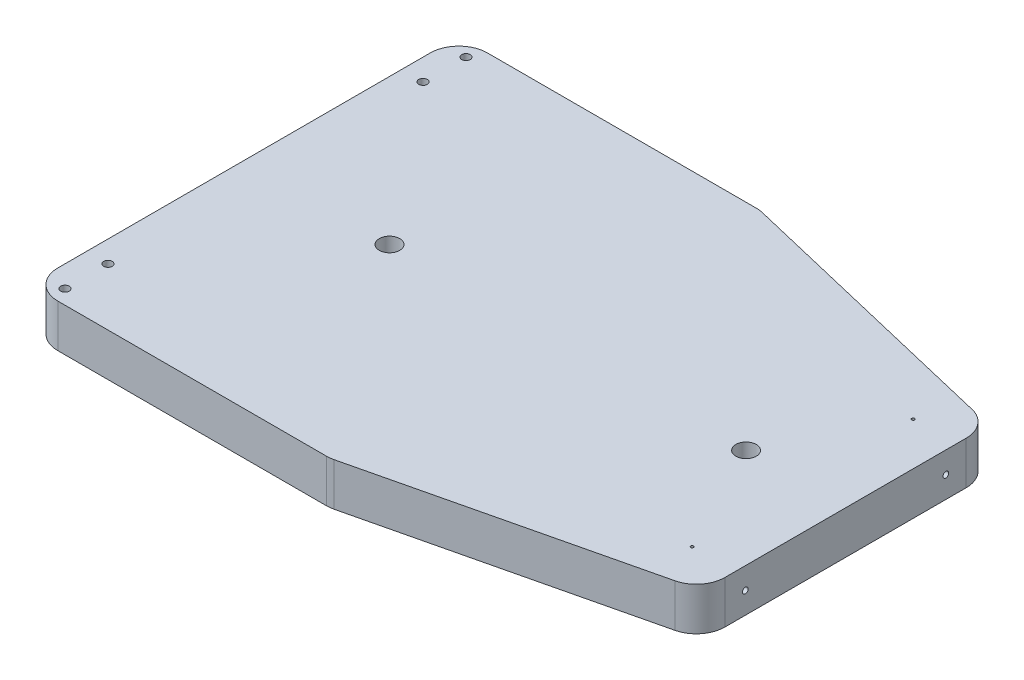
from build123d import *

# Parameters (mm, degrees)
ESBO_O1_R                = 3.571875
ESBO_O1_R_2              = 3.57
ESBO_O1_R_3              = 1.5
ESBO_O1_R_4              = 0.5
RESSALTO_EXTRUS_O1_DEPTH = 15
ESBO_O2_R                = 1
CORTE_EXTRUS_O1_DEPTH    = 10
FILETE1_R                = 10


with BuildPart() as part:
    # Esboço1 → Ressalto-extrusão1 (new body)
    with BuildSketch(Plane(origin=(0, 0, 0), x_dir=(1, 0, 0), z_dir=(0, 1, 0))):
        Polygon((210, 50), (105, 75), (0, 75), (0, -75), (105, -75), (210, -50), align=None)
        with Locations((50.8, 0)):
            Circle(ESBO_O1_R, mode=Mode.SUBTRACT)
        with Locations((175.26, 0)):
            Circle(ESBO_O1_R_2, mode=Mode.SUBTRACT)
        with Locations((7.5, -70)):
            Circle(ESBO_O1_R_3, mode=Mode.SUBTRACT)
        with Locations((7.5, -55)):
            Circle(ESBO_O1_R_3, mode=Mode.SUBTRACT)
        with Locations((7.5, 55)):
            Circle(ESBO_O1_R_3, mode=Mode.SUBTRACT)
        with Locations((7.5, 70)):
            Circle(ESBO_O1_R_3, mode=Mode.SUBTRACT)
        with Locations((195, -38.571428571)):
            Circle(ESBO_O1_R_4, mode=Mode.SUBTRACT)
        with Locations((195, 38.571428571)):
            Circle(ESBO_O1_R_4, mode=Mode.SUBTRACT)
    extrude(amount=RESSALTO_EXTRUS_O1_DEPTH)

    # Esboço2 → Corte-extrusão1 (cut)
    with BuildSketch(Plane(origin=(210, 0, 0), x_dir=(0, 0, -1), z_dir=(1, 0, 0))):
        with Locations((-35, 7.5)):
            Circle(ESBO_O2_R)
        with Locations((35, 7.5)):
            Circle(ESBO_O2_R)
    extrude(amount=-CORTE_EXTRUS_O1_DEPTH, mode=Mode.SUBTRACT)

    # Filete1
    filete1_edges = [part.edges().sort_by_distance(p)[0] for p in [
        (0, 7.5, 75),
        (105, 7.5, 75),
        (210, 7.5, 50),
        (210, 7.5, -50),
        (0, 7.5, -75),
        (105, 7.5, -75),
    ]]
    fillet(filete1_edges, radius=FILETE1_R)


solid = part.part
